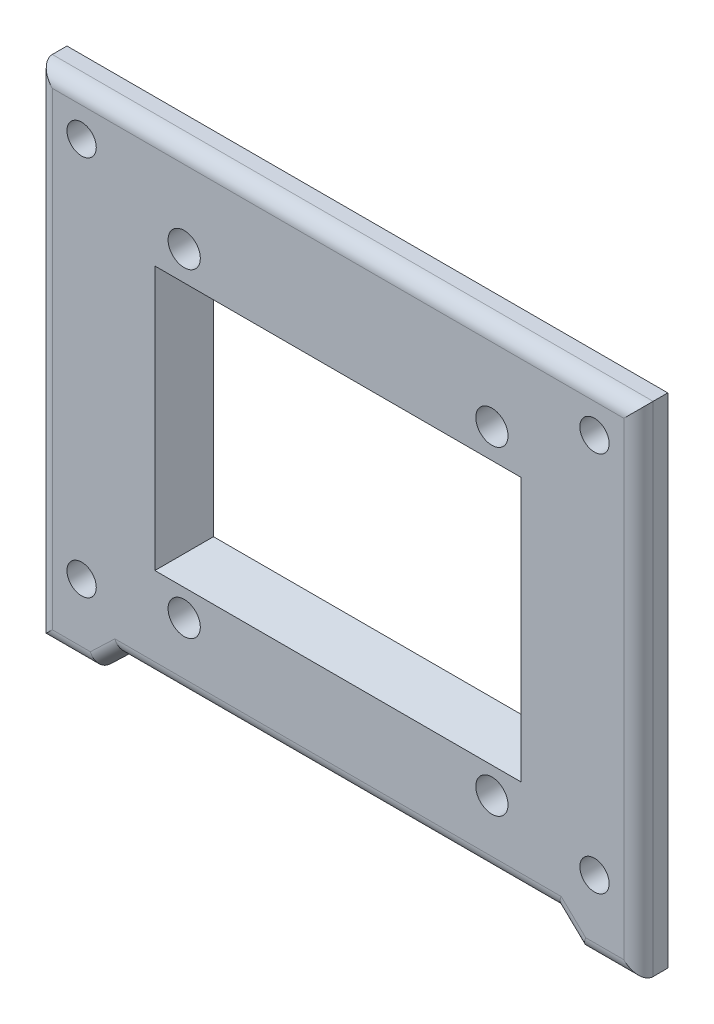
from build123d import *

# Parameters (mm, degrees)
SKETCH_1_R          = 1.1
SKETCH_1_W          = 21
SKETCH_1_H          = 14
EXTRUDE_1_DEPTH     = 2
FILLET_2_R          = 1
SKETCH_11_R         = 1
CUT_EXTRUDE_1_DEPTH = 33.917032345
CHAMFER_1_SIZE      = 2


with BuildPart() as part:
    # 草图1 → 凸台-拉伸1 (new body)
    with BuildSketch(Plane.XY):
        Polygon((-21.428351104, 24.906962627), (19.571648896, 24.906962627), (19.571648896, -9.093037373), (17.69677195, -9.093037373), (15.571648896, -9.093037373), (13.89965532, -7.493037373), (-15.756357529, -7.493037373), (-17.428351104, -9.093037373), (-21.428351104, -9.093037373), align=None)
        with Locations((-11.428351104, 18.906962627)):
            Circle(SKETCH_1_R, mode=Mode.SUBTRACT)
        with Locations((-11.428351104, -2.893037373)):
            Circle(SKETCH_1_R, mode=Mode.SUBTRACT)
        with Locations((9.571648896, 18.906962627)):
            Circle(SKETCH_1_R, mode=Mode.SUBTRACT)
        with Locations((9.571648896, -2.893037373)):
            Circle(SKETCH_1_R, mode=Mode.SUBTRACT)
        with Locations((-0.928351104, 7.906962627)):
            Rectangle(SKETCH_1_W, SKETCH_1_H, mode=Mode.SUBTRACT)
    extrude(amount=EXTRUDE_1_DEPTH)

    # 圆角2
    fillet_2_edges = [part.edges().sort_by_distance(p)[0] for p in [
        (-16.592354317, -8.293037373, 2),
        (-0.928351104, -7.493037373, 2),
        (14.735652108, -8.293037373, 2),
        (17.571648896, -9.093037373, 2),
        (19.571648896, 7.906962627, 2),
        (-0.928351104, 24.906962627, 2),
        (-21.428351104, 7.906962627, 2),
        (-19.428351104, -9.093037373, 2),
    ]]
    fillet(fillet_2_edges, radius=FILLET_2_R)

    # 草图11 → 切除-拉伸1 (cut, through all)
    with BuildSketch(Plane.XY.offset(2)):
        with Locations((-18.428351104, 21.906962627)):
            Circle(SKETCH_11_R)
        with Locations((-18.428351104, -4.093037373)):
            Circle(SKETCH_11_R)
        with Locations((16.571648896, 21.906962627)):
            Circle(SKETCH_11_R)
        with Locations((16.571648896, -4.093037373)):
            Circle(SKETCH_11_R)
    extrude(amount=-CUT_EXTRUDE_1_DEPTH, mode=Mode.SUBTRACT)

    # 倒角1
    chamfer_1_edges = [part.edges().sort_by_distance(p)[0] for p in [
        (-0.928351104, 0.906962627, 2),
        (9.571648896, 7.906962627, 2),
        (-11.428351104, 7.906962627, 2),
        (-0.928351104, 14.906962627, 2),
    ]]
    chamfer(chamfer_1_edges, length=CHAMFER_1_SIZE - 0.0001)  # a hair under: the kernel refuses the full size


solid = part.part
